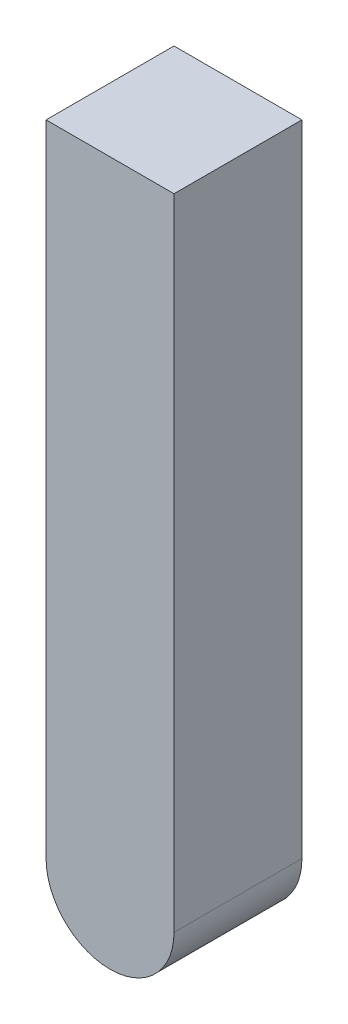
from build123d import *

# Parameters (mm, degrees)
ESQUISSE1_W        = 20
ESQUISSE1_H        = 110
BOSS_EXTRU_1_DEPTH = 20
CONG_3_R           = 10


with BuildPart() as part:
    # Esquisse1 → Boss.-Extru.1 (new body)
    with BuildSketch(Plane.XY):
        with Locations((10, 55)):
            Rectangle(ESQUISSE1_W, ESQUISSE1_H)
    extrude(amount=BOSS_EXTRU_1_DEPTH)

    # Congé3
    cong_3_edges = [part.edges().sort_by_distance(p)[0] for p in [
        (0, 0, 10),
        (20, 0, 10),
    ]]
    fillet(cong_3_edges, radius=CONG_3_R - 0.0001)  # a hair under: the kernel refuses the full size


solid = part.part
